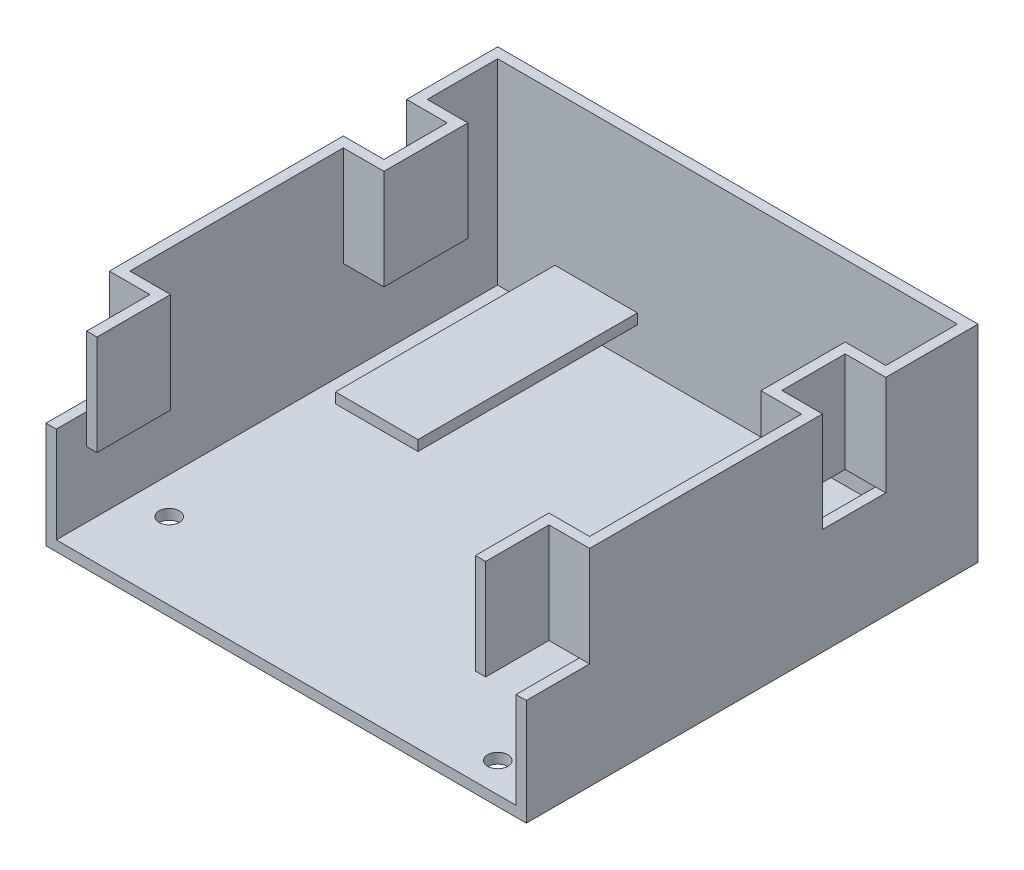
from build123d import *

# Parameters (mm, degrees)
SKETCH1_W            = 89.12
SKETCH1_H            = 85.57
BOSS_EXTRUDE1_DEPTH  = 2
SKETCH3_W            = 2
SKETCH3_H            = 30
BOSS_EXTRUDE2_DEPTH  = 85.57
SKETCH4_W            = 2
SKETCH4_H            = 30
BOSS_EXTRUDE3_DEPTH  = 85.57
SKETCH5_W            = 93.12
SKETCH5_H            = 2
BOSS_EXTRUDE4_DEPTH  = 30
SKETCH6_R            = 1.96
CUT_EXTRUDE2_DEPTH   = 30
SKETCH7_R            = 1.96
CUT_EXTRUDE3_DEPTH   = 30
SKETCH8_R            = 1.96
CUT_EXTRUDE4_DEPTH   = 30
SKETCH9_R            = 1.96
CUT_EXTRUDE5_DEPTH   = 30
BOSS_EXTRUDE5_DEPTH  = 9.4
SKETCH12_W           = 2
SKETCH12_H           = 12.27
CUT_EXTRUDE6_DEPTH   = 9.4
BOSS_EXTRUDE6_DEPTH  = 9.4
SKETCH14_W           = 2
SKETCH14_H           = 12.27
CUT_EXTRUDE7_DEPTH   = 9.4
BOSS_EXTRUDE7_DEPTH  = 9.4
SKETCH16_W           = 2
SKETCH16_H           = 12.27
CUT_EXTRUDE8_DEPTH   = 9.4
BOSS_EXTRUDE8_DEPTH  = 9.4
SKETCH18_W           = 2
SKETCH18_H           = 12.27
CUT_EXTRUDE9_DEPTH   = 9.4
BOSS_EXTRUDE9_DEPTH  = 10
SKETCH20_W           = 16
SKETCH20_H           = 42.55
BOSS_EXTRUDE10_DEPTH = 8.88
SKETCH21_W           = 16
SKETCH21_H           = 6.88
CUT_EXTRUDE10_DEPTH  = 42.55


with BuildPart() as part:
    # Sketch1 → Boss-Extrude1 (new body)
    with BuildSketch(Plane(origin=(0, 0, 0), x_dir=(1, 0, 0), z_dir=(0, 1, 0))):
        with Locations((44.56, 42.785)):
            Rectangle(SKETCH1_W, SKETCH1_H)
    extrude(amount=BOSS_EXTRUDE1_DEPTH)

    # Sketch3 → Boss-Extrude2 (add)
    with BuildSketch(Plane.XY):
        with Locations((-1, 15)):
            Rectangle(SKETCH3_W, SKETCH3_H)
    extrude(amount=-BOSS_EXTRUDE2_DEPTH)

    # Sketch4 → Boss-Extrude3 (add)
    with BuildSketch(Plane.XY):
        with Locations((90.12, 15)):
            Rectangle(SKETCH4_W, SKETCH4_H)
    extrude(amount=-BOSS_EXTRUDE3_DEPTH)

    # Sketch5 → Boss-Extrude4 (add)
    with BuildSketch(Plane(origin=(0, 0, 0), x_dir=(1, 0, 0), z_dir=(0, 1, 0))):
        with Locations((44.56, 86.57)):
            Rectangle(SKETCH5_W, SKETCH5_H)
    extrude(amount=BOSS_EXTRUDE4_DEPTH)

    # Sketch6 → Cut-Extrude2 (cut)
    with BuildSketch(Plane(origin=(0, 0, 0), x_dir=(1, 0, 0), z_dir=(0, 1, 0))):
        with Locations((79.835, 5.755)):
            Circle(SKETCH6_R)
    extrude(amount=CUT_EXTRUDE2_DEPTH, mode=Mode.SUBTRACT)

    # Sketch7 → Cut-Extrude3 (cut)
    with BuildSketch(Plane(origin=(0, 2, 0), x_dir=(1, 0, 0), z_dir=(0, 1, 0))):
        with Locations((82.285, 76.225)):
            Circle(SKETCH7_R)
    extrude(amount=-CUT_EXTRUDE3_DEPTH, mode=Mode.SUBTRACT)

    # Sketch8 → Cut-Extrude4 (cut)
    with BuildSketch(Plane(origin=(0, 0, 0), x_dir=(1, 0, 0), z_dir=(0, 1, 0))):
        with Locations((6.985, 78.28)):
            Circle(SKETCH8_R)
    extrude(amount=CUT_EXTRUDE4_DEPTH, mode=Mode.SUBTRACT)

    # Sketch9 → Cut-Extrude5 (cut)
    with BuildSketch(Plane(origin=(0, 2, 0), x_dir=(1, 0, 0), z_dir=(0, 1, 0))):
        with Locations((7.035, 14.85)):
            Circle(SKETCH9_R)
    extrude(amount=-CUT_EXTRUDE5_DEPTH, mode=Mode.SUBTRACT)

    # Sketch11 → Boss-Extrude5 (add)
    with BuildSketch(Plane(origin=(0, 30, 0), x_dir=(1, 0, 0), z_dir=(0, 1, 0))):
        Polygon((81.24, 0), (83.24, 0), (83.24, 12.27), (89.12, 12.27), (89.12, 14.27), (81.24, 14.27), align=None)
    extrude(amount=-BOSS_EXTRUDE5_DEPTH)

    # Sketch12 → Cut-Extrude6 (cut)
    with BuildSketch(Plane(origin=(0, 30, 0), x_dir=(1, 0, 0), z_dir=(0, 1, 0))):
        with Locations((90.12, 6.135)):
            Rectangle(SKETCH12_W, SKETCH12_H)
    extrude(amount=-CUT_EXTRUDE6_DEPTH, mode=Mode.SUBTRACT)

    # Sketch13 → Boss-Extrude6 (add)
    with BuildSketch(Plane(origin=(0, 30, 0), x_dir=(1, 0, 0), z_dir=(0, 1, 0))):
        Polygon((89.12, 55.359786784), (89.12, 57.43), (83.24, 57.43), (83.24, 69.7), (89.12, 69.7), (89.12, 71.7), (81.24, 71.7), (81.24, 55.359786784), align=None)
    extrude(amount=-BOSS_EXTRUDE6_DEPTH)

    # Sketch14 → Cut-Extrude7 (cut)
    with BuildSketch(Plane(origin=(0, 30, 0), x_dir=(1, 0, 0), z_dir=(0, 1, 0))):
        with Locations((90.12, 63.565)):
            Rectangle(SKETCH14_W, SKETCH14_H)
    extrude(amount=-CUT_EXTRUDE7_DEPTH, mode=Mode.SUBTRACT)

    # Sketch15 → Boss-Extrude7 (add)
    with BuildSketch(Plane(origin=(0, 30, 0), x_dir=(1, 0, 0), z_dir=(0, 1, 0))):
        Polygon((5.88, 57.64), (0, 57.64), (0, 55.64), (7.88, 55.64), (7.88, 71.91), (0, 71.91), (0, 69.91), (5.88, 69.91), align=None)
    extrude(amount=-BOSS_EXTRUDE7_DEPTH)

    # Sketch16 → Cut-Extrude8 (cut)
    with BuildSketch(Plane(origin=(0, 30, 0), x_dir=(1, 0, 0), z_dir=(0, 1, 0))):
        with Locations((-1, 63.775)):
            Rectangle(SKETCH16_W, SKETCH16_H)
    extrude(amount=-CUT_EXTRUDE8_DEPTH, mode=Mode.SUBTRACT)

    # Sketch17 → Boss-Extrude8 (add)
    with BuildSketch(Plane(origin=(0, 30, 0), x_dir=(1, 0, 0), z_dir=(0, 1, 0))):
        Polygon((5.88, 12.27), (5.88, 0), (7.88, 0), (7.88, 14.27), (0, 14.27), (0, 12.27), align=None)
    extrude(amount=-BOSS_EXTRUDE8_DEPTH)

    # Sketch18 → Cut-Extrude9 (cut)
    with BuildSketch(Plane(origin=(0, 30, 0), x_dir=(1, 0, 0), z_dir=(0, 1, 0))):
        with Locations((-1, 6.135)):
            Rectangle(SKETCH18_W, SKETCH18_H)
    extrude(amount=-CUT_EXTRUDE9_DEPTH, mode=Mode.SUBTRACT)

    # Sketch19 → Boss-Extrude9 (add)
    with BuildSketch(Plane(origin=(0, 30, 0), x_dir=(1, 0, 0), z_dir=(0, 1, 0))):
        Polygon((83.24, 0), (81.24, 0), (81.24, 14.27), (89.12, 14.27), (89.12, 55.359786784), (81.24, 55.359786784), (81.24, 71.7), (89.12, 71.7), (89.12, 85.57), (0, 85.57), (0, 71.91), (7.88, 71.91), (7.88, 55.64), (0, 55.64), (0, 14.27), (7.88, 14.27), (7.88, 0), (5.88, 0), (5.88, 12.27), (-2, 12.27), (-2, 57.64), (5.88, 57.64), (5.88, 69.91), (-2, 69.91), (-2, 87.57), (91.12, 87.57), (91.12, 69.7), (83.24, 69.7), (83.24, 57.43), (91.12, 57.43), (91.12, 12.27), (83.24, 12.27), align=None)
    extrude(amount=BOSS_EXTRUDE9_DEPTH)

    # Sketch20 → Boss-Extrude10 (add)
    with BuildSketch(Plane(origin=(0, 2, 0), x_dir=(1, 0, 0), z_dir=(0, 1, 0))):
        with Locations((19.1, 64.295)):
            Rectangle(SKETCH20_W, SKETCH20_H)
    extrude(amount=BOSS_EXTRUDE10_DEPTH)

    # Sketch21 → Cut-Extrude10 (cut)
    with BuildSketch(Plane.XY.offset(-43.02)):
        with Locations((19.1, 5.44)):
            Rectangle(SKETCH21_W, SKETCH21_H)
    extrude(amount=-CUT_EXTRUDE10_DEPTH, mode=Mode.SUBTRACT)


solid = part.part
